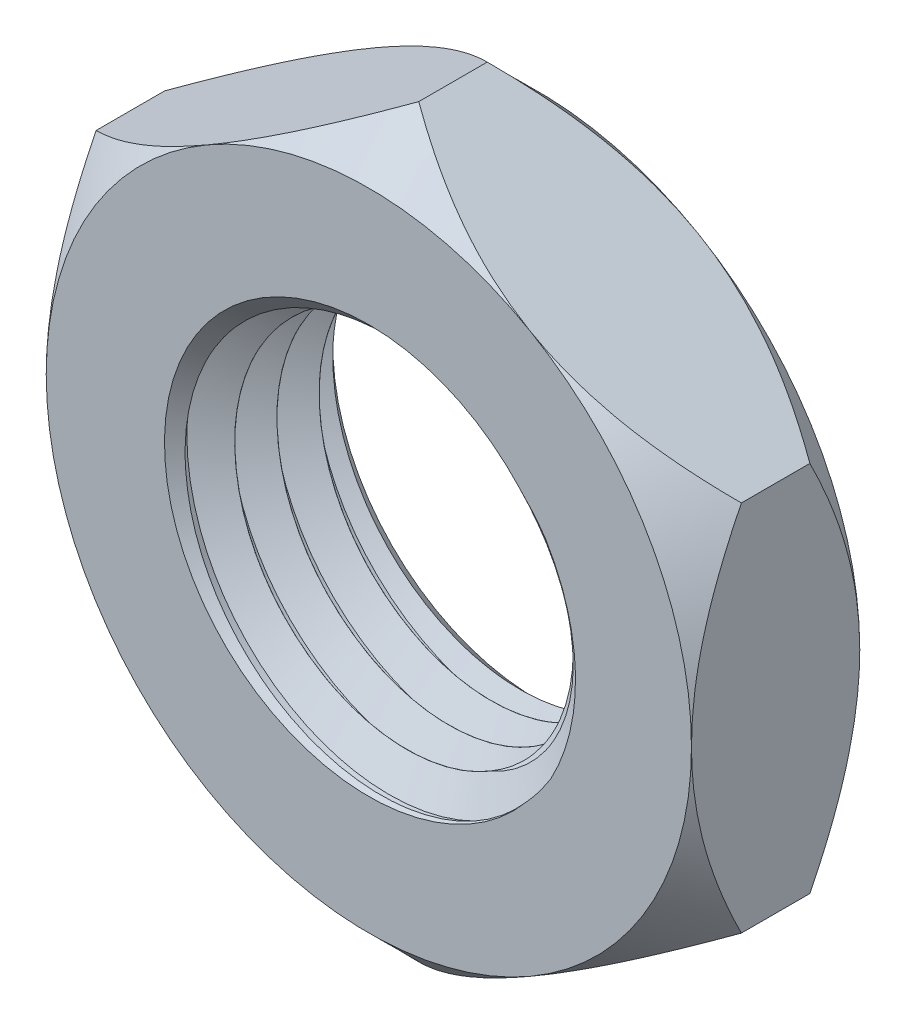
from build123d import *

# Parameters (mm, degrees)
BOSS_EXTRUDE1_DEPTH     = 1.5
SKETCH2_OUTSIDE_W       = 37.628
SKETCH2_OUTSIDE_H       = 39.408
SKETCH2_OUTSIDE_R       = 5.75
CUT_EXTRUDE1_DEPTH      = 10.281477971
CUT_EXTRUDE1_DRAFT      = -45
MIRROR1_COPY_1_SKETCH_W = 37.628
MIRROR1_COPY_1_SKETCH_H = 39.408
MIRROR1_COPY_1_SKETCH_R = 5.75
MIRROR1_COPY_1_DEPTH    = 10.281477971
MIRROR1_COPY_1_DRAFT    = -45
SKETCH3_R               = 3.1425
CUT_EXTRUDE2_DEPTH      = 10.281477971
CHAMFER1_SIZE           = 0.5
THREAD1_PITCH           = 0.752


with BuildPart() as part:
    # Sketch1 → Boss-Extrude1 (new, symmetric)
    with BuildSketch(Plane(origin=(0, 0, 0), x_dir=(0, 1, 0), z_dir=(0, 0, 1))):
        Polygon((6.639528096, 0), (3.319764048, 5.75), (-3.319764048, 5.75), (-6.639528096, 0), (-3.319764048, -5.75), (3.319764048, -5.75), align=None)
    extrude(amount=BOSS_EXTRUDE1_DEPTH, both=True)


with BuildPart() as cut_extrude1_tool:
    # Sketch2 outside → Cut-Extrude1 (with draft: the straight prism first)
    with BuildSketch(Plane.XY.offset(1.5)):
        Rectangle(SKETCH2_OUTSIDE_W, SKETCH2_OUTSIDE_H)
        Circle(SKETCH2_OUTSIDE_R, mode=Mode.SUBTRACT)
    extrude(amount=-CUT_EXTRUDE1_DEPTH)
    # Cut-Extrude1: the draft: its side faces are tilted about the plane it starts from
    cut_extrude1_sides = [cut_extrude1_tool.faces().sort_by_distance(p)[0] for p in [
        (0, -19.704, -3.640738986),
        (18.814, 0, -3.640738986),
        (0, 19.704, -3.640738986),
        (-18.814, 0, -3.640738986),
        (-5.75, 0, -3.640738986),
    ]]
    draft(cut_extrude1_sides, Plane.XY.offset(1.5), CUT_EXTRUDE1_DRAFT)


with BuildPart() as part_1:
    add(part.part)

    # Cut-Extrude1: cut by cut_extrude1_tool
    add(cut_extrude1_tool.part, mode=Mode.SUBTRACT)


with BuildPart() as mirror1_copy_1_tool:
    # Mirror1 copy 1 sketch → Mirror1 copy 1 (with draft: the straight prism first)
    with BuildSketch(Plane(origin=(0, 0, -1.5), x_dir=(1, 0, 0), z_dir=(0, 0, -1))):
        Rectangle(MIRROR1_COPY_1_SKETCH_W, MIRROR1_COPY_1_SKETCH_H)
        Circle(MIRROR1_COPY_1_SKETCH_R, mode=Mode.SUBTRACT)
    extrude(amount=-MIRROR1_COPY_1_DEPTH)
    # Mirror1 copy 1: the draft: its side faces are tilted about the plane it starts from
    mirror1_copy_1_sides = [mirror1_copy_1_tool.faces().sort_by_distance(p)[0] for p in [
        (0, -19.704, 3.640738986),
        (18.814, 0, 3.640738986),
        (0, 19.704, 3.640738986),
        (-18.814, 0, 3.640738986),
        (-5.75, 0, 3.640738986),
    ]]
    draft(mirror1_copy_1_sides, Plane(origin=(0, 0, -1.5), x_dir=(1, 0, 0), z_dir=(0, 0, -1)), MIRROR1_COPY_1_DRAFT)


with BuildPart() as part_2:
    add(part_1.part)

    # Mirror1 copy 1: cut by mirror1_copy_1_tool
    add(mirror1_copy_1_tool.part, mode=Mode.SUBTRACT)

    # Sketch3 → Cut-Extrude2 (cut, through all)
    with BuildSketch(Plane.XY.offset(1.5)):
        Circle(SKETCH3_R)
    extrude(amount=-CUT_EXTRUDE2_DEPTH, mode=Mode.SUBTRACT)

    # Chamfer1
    chamfer1_edges = [part_2.edges().sort_by_distance(p)[0] for p in [
        (-3.1425, 0, -1.5),
        (-3.1425, 0, 1.5),
    ]]
    chamfer(chamfer1_edges, length=CHAMFER1_SIZE)

    # Thread1: the profile of Thread Profile5 profile screwed along a right-hand helix of 5.984043 turns, 8 arcs to a turn; built about Z, then put on its axis
    thread1_z = Axis((0, 0, 0), (0, 0, 1))
    thread1_corners = [(3.1422, 0, -0.000173205), (3.683765875, 0, 0.312499999), (3.683765875, 0, 0.437499999), (3.1422, 0, 0.750173202)]
    with BuildLine(mode=Mode.PRIVATE) as thread1_profile:
        Line(thread1_corners[0], thread1_corners[1])
        Line(thread1_corners[1], thread1_corners[2])
        Line(thread1_corners[2], thread1_corners[3])
        Line(thread1_corners[3], thread1_corners[0])
    thread1_cap = Face(thread1_profile.wire())
    thread1_turn_angles = [0, 22.5, 45, 67.5, 90, 112.5, 135, 157.5, 180, 202.5, 225, 247.5, 270, 292.5, 315, 337.5, 360]
    thread1_turn_weights = [1, 0.9238795325112867, 1, 0.9238795325112867, 1, 0.9238795325112867, 1, 0.9238795325112867, 1, 0.9238795325112867, 1, 0.9238795325112867, 1, 0.9238795325112867, 1, 0.9238795325112867, 1]
    thread1_turn_rails = [Edge.make_bspline([Vector(p[0], p[1], 0).rotate(thread1_z, thread1_turn_angles[k]) / thread1_turn_weights[k] + Vector(0, 0, p[2] + THREAD1_PITCH * thread1_turn_angles[k] / 360) for k in range(17)], [0, 0, 0, 1, 1, 2, 2, 3, 3, 4, 4, 5, 5, 6, 6, 7, 7, 8, 8, 8], 2, thread1_turn_weights) for p in thread1_corners]
    thread1_turn_sides = [Face.make_surface_from_curves(thread1_turn_rails[p[0]], thread1_turn_rails[p[1]]) for p in [(0, 1), (1, 2), (2, 3), (3, 0)]]
    thread1_last_angles = [1800, 1822.5, 1845, 1867.5, 1890, 1912.5, 1935, 1957.5, 1980, 2002.5, 2025, 2047.5, 2070, 2092.5, 2115, 2134.627659574, 2154.255319149]
    thread1_last_weights = [1, 0.9238795325112867, 1, 0.9238795325112867, 1, 0.9238795325112867, 1, 0.9238795325112867, 1, 0.9238795325112867, 1, 0.9238795325112867, 1, 0.9238795325112867, 1, 0.9418954035598128, 1]
    thread1_last_rails = [Edge.make_bspline([Vector(p[0], p[1], 0).rotate(thread1_z, thread1_last_angles[k]) / thread1_last_weights[k] + Vector(0, 0, p[2] + THREAD1_PITCH * thread1_last_angles[k] / 360) for k in range(17)], [0, 0, 0, 1, 1, 2, 2, 3, 3, 4, 4, 5, 5, 6, 6, 7, 7, 8, 8, 8], 2, thread1_last_weights) for p in thread1_corners]
    thread1_last_sides = [Face.make_surface_from_curves(thread1_last_rails[p[0]], thread1_last_rails[p[1]]) for p in [(0, 1), (1, 2), (2, 3), (3, 0)]]
    thread1 = Plane(origin=(0, 0, 3), x_dir=(-1, 0, 0), z_dir=(0, 0, -1)) * Solid(Shell([*[p.moved(Location((0, 0, THREAD1_PITCH * i))) for i in range(5) for p in thread1_turn_sides], *thread1_last_sides, thread1_cap, thread1_cap.rotate(thread1_z, 2154.255319149).moved(Location((0, 0, THREAD1_PITCH * 2154.255319149 / 360)))]))
    add(thread1, mode=Mode.SUBTRACT)


solid = part_2.part
